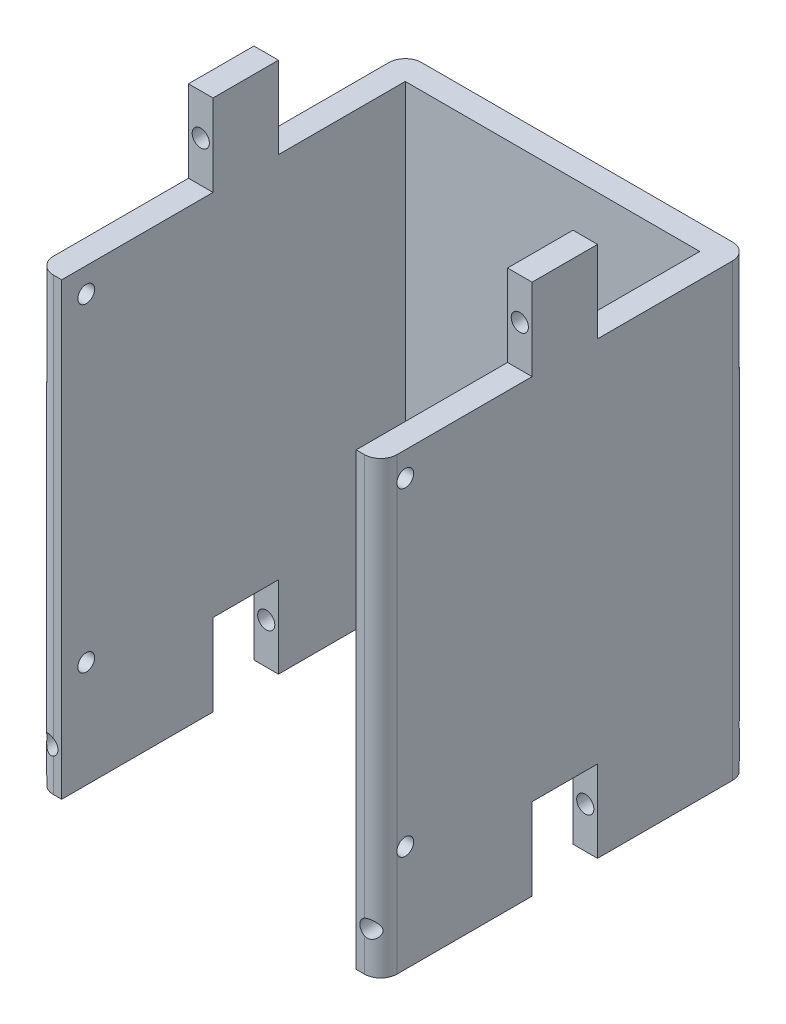
from build123d import *

# Parameters (mm, degrees)
EXTRUDE_1_DEPTH      = 40
EXTRUDE_1_DEPTH_BACK = 5
SKETCH_2_W           = 36
SKETCH_2_H           = 37
CUT_EXTRUDE_1_DEPTH  = 50
SKETCH_5_W           = 36
SKETCH_5_H           = 5
CUT_EXTRUDE_4_DEPTH  = 43
SKETCH_9_R           = 1.025
CUT_EXTRUDE_5_DEPTH  = 45.5
SKETCH_10_W          = 3
SKETCH_10_H          = 8
EXTRUDE_4_DEPTH      = 10
SKETCH_11_W          = 3
SKETCH_11_H          = 18.5
EXTRUDE_5_DEPTH      = 10
SKETCH_12_R          = 1.05
CUT_EXTRUDE_6_DEPTH  = 10
SKETCH_13_R          = 1.05
CUT_EXTRUDE_7_DEPTH  = 63.5
FILLET_4_R           = 2
FILLET_5_R           = 2
FILLET_6_R           = 2
FILLET_7_R           = 2


with BuildPart() as part:
    # 草圖1 → 填料-伸長1 (new, two sides: drawn at the far end of the back side and taken through both)
    with BuildSketch(Plane.XY.offset(-EXTRUDE_1_DEPTH_BACK)):
        Polygon((-14.545454545, -28.090909091), (-15.545454545, -28.090909091), (-15.545454545, 16.909090909), (-14.545454545, 16.909090909), (25.454545455, 16.909090909), (26.454545455, 16.909090909), (26.454545455, -28.090909091), (25.454545455, -28.090909091), align=None)
    extrude(amount=EXTRUDE_1_DEPTH + EXTRUDE_1_DEPTH_BACK)

    # 草圖2 → 除料-伸長1 (cut)
    with BuildSketch(Plane(origin=(0, 16.909090909, 0), x_dir=(1, 0, 0), z_dir=(0, 1, 0))):
        with Locations((5.454545455, -21.5)):
            Rectangle(SKETCH_2_W, SKETCH_2_H)
    extrude(amount=-CUT_EXTRUDE_1_DEPTH, mode=Mode.SUBTRACT)

    # 草圖5 → 除料-伸長4 (cut)
    with BuildSketch(Plane(origin=(0, 16.909090909, 0), x_dir=(1, 0, 0), z_dir=(0, 1, 0))):
        with Locations((5.454545455, -0.5)):
            Rectangle(SKETCH_5_W, SKETCH_5_H)
    extrude(amount=-CUT_EXTRUDE_4_DEPTH, mode=Mode.SUBTRACT)

    # 草圖9 → 除料-伸長5 (cut)
    with BuildSketch(Plane.ZY.offset(15.545454545)):
        with Locations(Location((37, -25.090909091, 0), (0, 0, 180))):
            Circle(SKETCH_9_R)
        with Locations(Location((37, 13.909090909, 0), (0, 0, 180))):
            Circle(SKETCH_9_R)
    extrude(amount=-CUT_EXTRUDE_5_DEPTH, mode=Mode.SUBTRACT)

    # 草圖10 → 填料-伸長4 (add)
    with BuildSketch(Plane(origin=(0, 16.909090909, 0), x_dir=(1, 0, 0), z_dir=(0, 1, 0))):
        with Locations((-14.045454545, -17.5)):
            Rectangle(SKETCH_10_W, SKETCH_10_H)
        with Locations((24.954545455, -17.5)):
            Rectangle(SKETCH_10_W, SKETCH_10_H)
    extrude(amount=EXTRUDE_4_DEPTH)

    # 草圖11 → 填料-伸長5 (add)
    with BuildSketch(Plane(origin=(0, -28.090909091, 0), x_dir=(-1, 0, 0), z_dir=(0, -1, 0))):
        with Locations((-24.954545455, -30.75)):
            Rectangle(SKETCH_11_W, SKETCH_11_H)
        with Locations((-24.954545455, -4.25)):
            Rectangle(SKETCH_11_W, SKETCH_11_H)
        with Locations((14.045454545, -30.75)):
            Rectangle(SKETCH_11_W, SKETCH_11_H)
        with Locations((14.045454545, -4.25)):
            Rectangle(SKETCH_11_W, SKETCH_11_H)
    extrude(amount=EXTRUDE_5_DEPTH)

    # 草圖12 → 除料-伸長6 (cut)
    with BuildSketch(Plane(origin=(0, 0, 13.5), x_dir=(-1, 0, 0), z_dir=(0, 0, -1))):
        with Locations((-24.954545455, 21.909090909)):
            Circle(SKETCH_12_R)
        with Locations((14.045454545, 21.909090909)):
            Circle(SKETCH_12_R)
    extrude(amount=-CUT_EXTRUDE_6_DEPTH, mode=Mode.SUBTRACT)

    # 草圖13 → 除料-伸長7 (cut)
    with BuildSketch(Plane(origin=(0, 0, -5), x_dir=(-1, 0, 0), z_dir=(0, 0, -1))):
        with Locations((-24.954545455, -33.090909091)):
            Circle(SKETCH_13_R)
        with Locations((14.045454545, -33.090909091)):
            Circle(SKETCH_13_R)
    extrude(amount=-CUT_EXTRUDE_7_DEPTH, mode=Mode.SUBTRACT)

    # 圓角4
    # the kernel refuses this fillet: 2 mm, written as the material it takes off along each edge
    with BuildSketch(Plane(origin=(26.454545455, 21.909090909, -5), x_dir=(-1, 0, 0), z_dir=(0, -1, 0))) as fillet_4_piece_1:
        with BuildLine():
            CenterArc((FILLET_4_R, -FILLET_4_R), FILLET_4_R, 90, 90)
            Line((0, -FILLET_4_R), (0, 0))
            Line((0, 0), (FILLET_4_R, 0))
        make_face()
    extrude(amount=65, mode=Mode.SUBTRACT)

    # 圓角5
    # the kernel refuses this fillet: 2 mm, written as the material it takes off along each edge
    with BuildSketch(Plane(origin=(-15.545454545, 21.909090909, -5), x_dir=(0, 0, 1), z_dir=(0, -1, 0))) as fillet_5_piece_1:
        with BuildLine():
            CenterArc((FILLET_5_R, -FILLET_5_R), FILLET_5_R, 90, 90)
            Line((0, -FILLET_5_R), (0, 0))
            Line((0, 0), (FILLET_5_R, 0))
        make_face()
    extrude(amount=65, mode=Mode.SUBTRACT)

    # 圓角6
    # the kernel refuses this fillet: 2 mm, written as the material it takes off along each edge
    with BuildSketch(Plane(origin=(26.454545455, 21.909090909, 40), x_dir=(0, 0, -1), z_dir=(0, -1, 0))) as fillet_6_piece_1:
        with BuildLine():
            CenterArc((FILLET_6_R, -FILLET_6_R), FILLET_6_R, 90, 90)
            Line((0, -FILLET_6_R), (0, 0))
            Line((0, 0), (FILLET_6_R, 0))
        make_face()
    extrude(amount=65, mode=Mode.SUBTRACT)

    # 圓角7
    # the kernel refuses this fillet: 2 mm, written as the material it takes off along each edge
    with BuildSketch(Plane(origin=(-15.545454545, -43.090909091, 40), x_dir=(0, 0, -1), z_dir=(0, 1, 0))) as fillet_7_piece_1:
        with BuildLine():
            CenterArc((FILLET_7_R, -FILLET_7_R), FILLET_7_R, 90, 90)
            Line((0, -FILLET_7_R), (0, 0))
            Line((0, 0), (FILLET_7_R, 0))
        make_face()
    extrude(amount=65, mode=Mode.SUBTRACT)


solid = part.part
